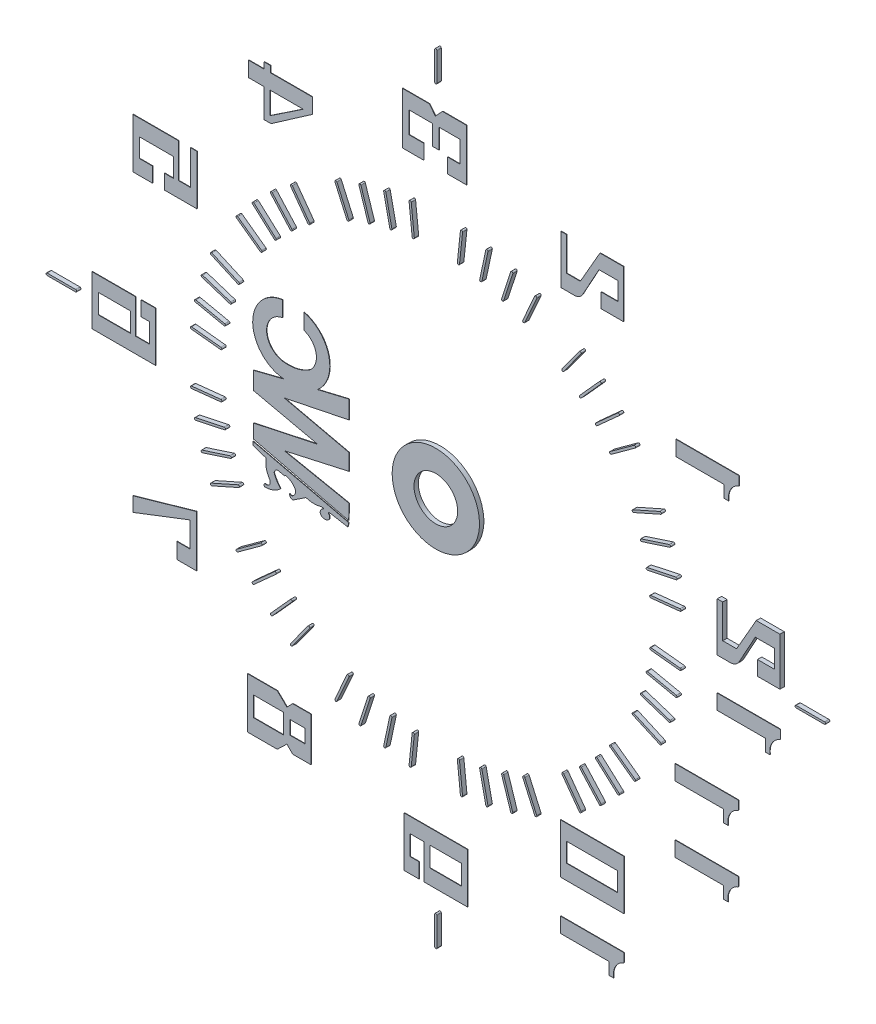
from build123d import *

# Parameters (mm, degrees)
BOSS_EXTRUDE1_OUTLINE_W   = 0.693153308
BOSS_EXTRUDE1_OUTLINE_H   = 0.62355464
BOSS_EXTRUDE1_OUTLINE_W_2 = 1.374444381
BOSS_EXTRUDE1_OUTLINE_H_2 = 0.902807992
BOSS_EXTRUDE1_OUTLINE_W_3 = 2.905976319
BOSS_EXTRUDE1_OUTLINE_H_3 = 2.27315436
BOSS_EXTRUDE1_OUTLINE_W_4 = 2.344736337
BOSS_EXTRUDE1_OUTLINE_H_4 = 0.874290332
BOSS_EXTRUDE1_OUTLINE_W_5 = 1.445092646
BOSS_EXTRUDE1_OUTLINE_H_5 = 0.908479698
BOSS_EXTRUDE1_OUTLINE_W_6 = 1.464797611
BOSS_EXTRUDE1_OUTLINE_H_6 = 0.892892655
BOSS_EXTRUDE1_OUTLINE_R   = 2
BOSS_EXTRUDE1_OUTLINE_R_2 = 1
BOSS_EXTRUDE1_DEPTH       = 0.2
CUT_EXTRUDE1_START        = -0.18
SKETCH4_R                 = 22.194214038
SKETCH4_R_2               = 11.335285241
SKETCH4_R_3               = 1.141976303
SKETCH4_R_4               = 1.14271963
SKETCH4_R_5               = 1.226028359
SKETCH4_R_6               = 1.09271963
SKETCH4_R_7               = 9.346177067
SKETCH4_R_8               = 3.583571814
CUT_EXTRUDE1_DEPTH        = 0.18


# Read off the part's stored shape, not the designer's step: Boss-Extrude1
with BuildPart() as part:
    # Boss-Extrude1 outline → Boss-Extrude1 (new body)
    # profile 1 of 70: a face of its own
    with BuildSketch(Plane(origin=(0, 0, 0), x_dir=(-1, 0, 0), z_dir=(0, 0, -1))):
        Polygon((10.955613983, -8.343638748), (11.85925555, -8.343638748), (11.85925555, -7.626212398), (11.24868691, -7.626212398), (11.24868691, -6.468547297), (13.870061363, -7.479466224), (13.870061363, -6.819107983), (10.955613983, -5.987545643), align=None)
    # profile 2 of 70: a face of its own
    with BuildSketch(Plane(origin=(0, 0, 0), x_dir=(-1, 0, 0), z_dir=(0, 0, -1))):
        Polygon((5.713113889, -13.412966941), (6.557142916, -13.412966941), (6.818567794, -13.143687857), (7.259255556, -13.570046465), (8.61866504, -13.570046465), (8.61866504, -11.252293033), (7.259255556, -11.252293033), (6.818567794, -11.678651641), (6.557142916, -11.409372556), (5.713113889, -11.409372556), align=None)
        with Locations((6.339051927, -12.411169749)):
            Rectangle(BOSS_EXTRUDE1_OUTLINE_W, BOSS_EXTRUDE1_OUTLINE_H, mode=Mode.SUBTRACT)
        with Locations((7.653607086, -12.410967049)):
            Rectangle(BOSS_EXTRUDE1_OUTLINE_W_2, BOSS_EXTRUDE1_OUTLINE_H_2, mode=Mode.SUBTRACT)
    # profile 3 of 70: a face of its own
    with BuildSketch(Plane(origin=(0, 0, 0), x_dir=(-1, 0, 0), z_dir=(0, 0, -1))):
        Polygon((7.875420776, 11.100165446), (7.875420776, 12.411169749), (8.576481811, 12.411169749), (8.576481811, 13.106065201), (7.862901797, 13.106065201), (7.862901797, 13.394413231), (7.574965976, 13.394413231), (7.574965976, 13.106065201), (5.659566961, 13.106065201), (5.659566961, 12.411169749), (7.549928117, 11.100165446), align=None)
        Polygon((7.594466881, 11.394557792), (6.072692174, 12.411169749), (7.594466881, 12.411169749), align=None, mode=Mode.SUBTRACT)
    # profile 4 of 70: a face of its own
    with BuildSketch(Plane(origin=(0, 0, 0), x_dir=(-1, 0, 0), z_dir=(0, 0, -1))):
        with Locations((-7.165592196, -11.018401973)):
            Rectangle(BOSS_EXTRUDE1_OUTLINE_W_3, BOSS_EXTRUDE1_OUTLINE_H_3)
        with Locations((-7.159356182, -11.030891763)):
            Rectangle(BOSS_EXTRUDE1_OUTLINE_W_4, BOSS_EXTRUDE1_OUTLINE_H_4, mode=Mode.SUBTRACT)
    # profile 5 of 70: a face of its own
    with BuildSketch(Plane(origin=(0, 0, 0), x_dir=(-1, 0, 0), z_dir=(0, 0, -1))):
        Polygon((13.580590302, 6.705510502), (12.971354188, 6.705510502), (12.971354188, 6.025389458), (13.880214604, 6.025389458), (13.880214604, 8.305794933), (11.78284429, 8.305794933), (11.78284429, 6.725514068), (11.233533036, 6.725514068), (11.233533036, 8.305794933), (10.943896144, 8.305794933), (10.943896144, 6.025389458), (12.422042834, 6.025389458), (12.422042834, 6.695508718), (12.021368813, 6.695508718), (12.021368813, 7.565663418), (13.580590302, 7.565663418), align=None)
    # profile 6 of 70: a face of its own
    with BuildSketch(Plane(origin=(0, 0, 0), x_dir=(-1, 0, 0), z_dir=(0, 0, -1))):
        Polygon((0.548614138, -13.87787068), (1.17251451, -13.87787068), (1.17251451, -14.786350378), (0.76513998, -14.786350378), (0.76513998, -15.472324961), (1.449221809, -15.472324961), (1.449221809, -13.190043821), (-1.449221809, -13.190043821), (-1.449221809, -15.472324961), (0.548614138, -15.472324961), align=None)
        with Locations((-0.446978155, -14.332110529)):
            Rectangle(BOSS_EXTRUDE1_OUTLINE_W_5, BOSS_EXTRUDE1_OUTLINE_H_5, mode=Mode.SUBTRACT)
    # profile 7 of 70: a face of its own
    with BuildSketch(Plane(origin=(0, 0, 0), x_dir=(-1, 0, 0), z_dir=(0, 0, -1))):
        Polygon((-1.413039117, 13.14806896), (-0.54342973, 13.14806896), (-0.54342973, 13.82316217), (-1.107496057, 13.82316217), (-1.107496057, 14.80824715), (-0.144455981, 14.80824715), (-0.144455981, 13.898937849), (0.144455981, 13.898937849), (0.144455981, 14.80824715), (1.231315442, 14.80824715), (1.231315442, 13.82316217), (0.550308579, 13.82316217), (0.550308579, 13.14806896), (1.528727873, 13.14806896), (1.528727873, 15.514299822), (0.297603982, 15.514299822), (0.018858966, 15.165369679), (-0.306343601, 15.514299822), (-1.413039117, 15.514299822), align=None)
    # profile 8 of 70: a face of its own
    with BuildSketch(Plane(origin=(0, 0, 0), x_dir=(-1, 0, 0), z_dir=(0, 0, -1))):
        Polygon((13.114345832, 0.464899605), (13.499321236, 0.464899605), (13.499321236, 1.133901722), (12.831275767, 1.133901722), (12.831275767, -1.133901722), (15.741236404, -1.133901722), (15.741236404, 1.133901722), (13.748422922, 1.133901722), (13.748422922, -0.430882673), (13.114345832, -0.430882673), align=None)
        with Locations((14.726297174, 0.00841343)):
            Rectangle(BOSS_EXTRUDE1_OUTLINE_W_6, BOSS_EXTRUDE1_OUTLINE_H_6, mode=Mode.SUBTRACT)
    # profile 9 of 70: a face of its own
    with BuildSketch(Plane(origin=(0, 0, 0), x_dir=(-1, 0, 0), z_dir=(0, 0, -1))):
        with BuildLine():
            ThreePointArc((-0.050002573, -17.800002573), (-2.573e-06, -17.850002573), (0.049997427, -17.800002573))
            Line((0.049997427, -17.800002573), (0.049997427, -16.5))
            ThreePointArc((0.049997427, -16.5), (-2.573e-06, -16.45), (-0.050002573, -16.5))
            Line((-0.050002573, -16.5), (-0.050002573, -17.800002573))
        make_face()
    # profile 10 of 70: a face of its own
    with BuildSketch(Plane(origin=(0, 0, 0), x_dir=(-1, 0, 0), z_dir=(0, 0, -1))):
        with BuildLine():
            ThreePointArc((16.5, 0.05), (16.45, 0), (16.5, -0.05))
            Line((16.5, -0.05), (17.8, -0.05))
            ThreePointArc((17.8, -0.05), (17.85, 0), (17.8, 0.05))
            Line((17.8, 0.05), (16.5, 0.05))
        make_face()
    # profile 11 of 70: a face of its own
    with BuildSketch(Plane(origin=(0, 0, 0), x_dir=(-1, 0, 0), z_dir=(0, 0, -1))):
        with BuildLine():
            ThreePointArc((-0.050002573, 16.5), (-2.573e-06, 16.45), (0.049997427, 16.5))
            Line((0.049997427, 16.5), (0.049997427, 17.799997427))
            ThreePointArc((0.049997427, 17.799997427), (-2.573e-06, 17.849997427), (-0.050002573, 17.799997427))
            Line((-0.050002573, 17.799997427), (-0.050002573, 16.5))
        make_face()
    # profile 12 of 70: a face of its own
    with BuildSketch(Plane(origin=(0, 0, 0), x_dir=(-1, 0, 0), z_dir=(0, 0, -1))):
        with BuildLine():
            ThreePointArc((-17.8, 0.05), (-17.85, 0), (-17.8, -0.05))
            Line((-17.8, -0.05), (-16.5, -0.05))
            ThreePointArc((-16.5, -0.05), (-16.45, 0), (-16.5, 0.05))
            Line((-16.5, 0.05), (-17.8, 0.05))
        make_face()
    # profile 13 of 70: a face of its own
    with BuildSketch(Plane(origin=(0, 0, 0), x_dir=(-1, 0, 0), z_dir=(0, 0, -1))):
        with BuildLine():
            ThreePointArc((-11.014555141, -2.290103622), (-11.053066936, -2.349406587), (-10.993763971, -2.387918382))
            Line((-10.993763971, -2.387918382), (-9.67326471, -2.107237599))
            ThreePointArc((-9.67326471, -2.107237599), (-9.634752915, -2.047934634), (-9.69405588, -2.009422839))
            Line((-9.69405588, -2.009422839), (-11.014555141, -2.290103622))
        make_face()
    # profile 14 of 70: a face of its own
    with BuildSketch(Plane(origin=(0, 0, 0), x_dir=(-1, 0, 0), z_dir=(0, 0, -1))):
        with BuildLine():
            ThreePointArc((-10.714835262, -3.428892657), (-10.746937238, -3.491896332), (-10.683933563, -3.523998309))
            Line((-10.683933563, -3.523998309), (-9.400007266, -3.106825366))
            ThreePointArc((-9.400007266, -3.106825366), (-9.36790529, -3.043821691), (-9.430908965, -3.011719715))
            Line((-9.430908965, -3.011719715), (-10.714835262, -3.428892657))
        make_face()
    # profile 15 of 70: a face of its own
    with BuildSketch(Plane(origin=(0, 0, 0), x_dir=(-1, 0, 0), z_dir=(0, 0, -1))):
        with BuildLine():
            ThreePointArc((-10.297721429, -4.530114009), (-10.323061869, -4.596128114), (-10.257047764, -4.621468555))
            Line((-10.257047764, -4.621468555), (-9.023761396, -4.072374087))
            ThreePointArc((-9.023761396, -4.072374087), (-8.998420956, -4.006359982), (-9.064435061, -3.981019541))
            Line((-9.064435061, -3.981019541), (-10.297721429, -4.530114009))
        make_face()
    # profile 16 of 70: a face of its own
    with BuildSketch(Plane(origin=(0, 0, 0), x_dir=(-1, 0, 0), z_dir=(0, 0, -1))):
        with BuildLine():
            ThreePointArc((-9.130827987, -6.572136627), (-9.141889575, -6.64197674), (-9.072049462, -6.653038327))
            Line((-9.072049462, -6.653038327), (-7.97987652, -5.859528236))
            ThreePointArc((-7.97987652, -5.859528236), (-7.968814933, -5.789688124), (-8.038655045, -5.778626536))
            Line((-8.038655045, -5.778626536), (-9.130827987, -6.572136627))
        make_face()
    # profile 17 of 70: a face of its own
    with BuildSketch(Plane(origin=(0, 0, 0), x_dir=(-1, 0, 0), z_dir=(0, 0, -1))):
        with BuildLine():
            ThreePointArc((-8.393833116, -7.49056508), (-8.397533827, -7.561178851), (-8.326920056, -7.564879562))
            Line((-8.326920056, -7.564879562), (-7.323674541, -6.661553243))
            ThreePointArc((-7.323674541, -6.661553243), (-7.31997383, -6.590939471), (-7.390587602, -6.587238761))
            Line((-7.390587602, -6.587238761), (-8.393833116, -7.49056508))
        make_face()
    # profile 18 of 70: a face of its own
    with BuildSketch(Plane(origin=(0, 0, 0), x_dir=(-1, 0, 0), z_dir=(0, 0, -1))):
        with BuildLine():
            ThreePointArc((-7.564873691, -8.326925342), (-7.56117298, -8.397539114), (-7.490559208, -8.393838403))
            Line((-7.490559208, -8.393838403), (-6.58723289, -7.390592888))
            ThreePointArc((-6.58723289, -7.390592888), (-6.590933601, -7.319979117), (-6.661547372, -7.323679828))
            Line((-6.661547372, -7.323679828), (-7.564873691, -8.326925342))
        make_face()
    # profile 19 of 70: a face of its own
    with BuildSketch(Plane(origin=(0, 0, 0), x_dir=(-1, 0, 0), z_dir=(0, 0, -1))):
        with BuildLine():
            ThreePointArc((-6.653031964, -9.072054085), (-6.641970376, -9.141894197), (-6.572130264, -9.13083261))
            Line((-6.572130264, -9.13083261), (-5.778620174, -8.038659668))
            ThreePointArc((-5.778620174, -8.038659668), (-5.789681761, -7.968819555), (-5.859521873, -7.979881143))
            Line((-5.859521873, -7.979881143), (-6.653031964, -9.072054085))
        make_face()
    # profile 20 of 70: a face of its own
    with BuildSketch(Plane(origin=(0, 0, 0), x_dir=(-1, 0, 0), z_dir=(0, 0, -1))):
        with BuildLine():
            ThreePointArc((-4.621461532, -10.257050891), (-4.596121091, -10.323064996), (-4.530106986, -10.297724555))
            Line((-4.530106986, -10.297724555), (-3.981012518, -9.064438188))
            ThreePointArc((-3.981012518, -9.064438188), (-4.006352959, -8.998424083), (-4.072367064, -9.023764523))
            Line((-4.072367064, -9.023764523), (-4.621461532, -10.257050891))
        make_face()
    # profile 21 of 70: a face of its own
    with BuildSketch(Plane(origin=(0, 0, 0), x_dir=(-1, 0, 0), z_dir=(0, 0, -1))):
        with BuildLine():
            ThreePointArc((-3.52399113, -10.683935895), (-3.491889154, -10.746939571), (-3.428885478, -10.714837595))
            Line((-3.428885478, -10.714837595), (-3.011712536, -9.430911298))
            ThreePointArc((-3.011712536, -9.430911298), (-3.043814512, -9.367907622), (-3.106818188, -9.400009598))
            Line((-3.106818188, -9.400009598), (-3.52399113, -10.683935895))
        make_face()
    # profile 22 of 70: a face of its own
    with BuildSketch(Plane(origin=(0, 0, 0), x_dir=(-1, 0, 0), z_dir=(0, 0, -1))):
        with BuildLine():
            ThreePointArc((-2.387911166, -10.993765505), (-2.349399371, -11.05306847), (-2.290096406, -11.014556674))
            Line((-2.290096406, -11.014556674), (-2.009415623, -9.694057413))
            ThreePointArc((-2.009415623, -9.694057413), (-2.047927419, -9.634754449), (-2.107230384, -9.673266244))
            Line((-2.107230384, -9.673266244), (-2.387911166, -10.993765505))
        make_face()
    # profile 23 of 70: a face of its own
    with BuildSketch(Plane(origin=(0, 0, 0), x_dir=(-1, 0, 0), z_dir=(0, 0, -1))):
        with BuildLine():
            ThreePointArc((-1.225668763, -11.183145167), (-1.181169092, -11.238097685), (-1.126216574, -11.193598013))
            Line((-1.126216574, -11.193598013), (-0.985103148, -9.850993455))
            ThreePointArc((-0.985103148, -9.850993455), (-1.02960282, -9.796040937), (-1.084555338, -9.840540608))
            Line((-1.084555338, -9.840540608), (-1.225668763, -11.183145167))
        make_face()
    # profile 24 of 70: a face of its own
    with BuildSketch(Plane(origin=(0, 0, 0), x_dir=(-1, 0, 0), z_dir=(0, 0, -1))):
        with BuildLine():
            ThreePointArc((1.084559943, -9.840540124), (1.029607425, -9.796040453), (0.985107754, -9.850992971))
            Line((0.985107754, -9.850992971), (1.126221179, -11.193597529))
            ThreePointArc((1.126221179, -11.193597529), (1.181173697, -11.238097201), (1.225673368, -11.183144683))
            Line((1.225673368, -11.183144683), (1.084559943, -9.840540124))
        make_face()
    # profile 25 of 70: a face of its own
    with BuildSketch(Plane(origin=(0, 0, 0), x_dir=(-1, 0, 0), z_dir=(0, 0, -1))):
        with BuildLine():
            ThreePointArc((2.107234913, -9.673265281), (2.047931948, -9.634753486), (2.009420153, -9.694056451))
            Line((2.009420153, -9.694056451), (2.290100936, -11.014555712))
            ThreePointArc((2.290100936, -11.014555712), (2.349403901, -11.053067507), (2.387915696, -10.993764542))
            Line((2.387915696, -10.993764542), (2.107234913, -9.673265281))
        make_face()
    # profile 26 of 70: a face of its own
    with BuildSketch(Plane(origin=(0, 0, 0), x_dir=(-1, 0, 0), z_dir=(0, 0, -1))):
        with BuildLine():
            ThreePointArc((3.428889882, -10.714836164), (3.491893558, -10.74693814), (3.523995534, -10.683934464))
            Line((3.523995534, -10.683934464), (3.106822592, -9.400008167))
            ThreePointArc((3.106822592, -9.400008167), (3.043818916, -9.367906191), (3.01171694, -9.430909867))
            Line((3.01171694, -9.430909867), (3.428889882, -10.714836164))
        make_face()
    # profile 27 of 70: a face of its own
    with BuildSketch(Plane(origin=(0, 0, 0), x_dir=(-1, 0, 0), z_dir=(0, 0, -1))):
        with BuildLine():
            ThreePointArc((4.072371294, -9.02376264), (4.006357189, -8.998422199), (3.981016748, -9.064436304))
            Line((3.981016748, -9.064436304), (4.530111217, -10.297722672))
            ThreePointArc((4.530111217, -10.297722672), (4.596125322, -10.323063113), (4.621465762, -10.257049008))
            Line((4.621465762, -10.257049008), (4.072371294, -9.02376264))
        make_face()
    # profile 28 of 70: a face of its own
    with BuildSketch(Plane(origin=(0, 0, 0), x_dir=(-1, 0, 0), z_dir=(0, 0, -1))):
        with BuildLine():
            ThreePointArc((6.572134011, -9.130829888), (6.641974123, -9.141891475), (6.65303571, -9.072051363))
            Line((6.65303571, -9.072051363), (5.85952562, -7.979878421))
            ThreePointArc((5.85952562, -7.979878421), (5.789685508, -7.968816834), (5.77862392, -8.038656946))
            Line((5.77862392, -8.038656946), (6.572134011, -9.130829888))
        make_face()
    # profile 29 of 70: a face of its own
    with BuildSketch(Plane(origin=(0, 0, 0), x_dir=(-1, 0, 0), z_dir=(0, 0, -1))):
        with BuildLine():
            ThreePointArc((6.661550814, -7.323676729), (6.590937042, -7.319976018), (6.587236331, -7.39058979))
            Line((6.587236331, -7.39058979), (7.49056265, -8.393835304))
            ThreePointArc((7.49056265, -8.393835304), (7.561176421, -8.397536015), (7.564877132, -8.326922244))
            Line((7.564877132, -8.326922244), (6.661550814, -7.323676729))
        make_face()
    # profile 30 of 70: a face of its own
    with BuildSketch(Plane(origin=(0, 0, 0), x_dir=(-1, 0, 0), z_dir=(0, 0, -1))):
        with BuildLine():
            ThreePointArc((8.326923154, -7.564876121), (8.397536926, -7.56117541), (8.393836215, -7.490561638))
            Line((8.393836215, -7.490561638), (7.3905907, -6.58723532))
            ThreePointArc((7.3905907, -6.58723532), (7.319976929, -6.590936031), (7.32367764, -6.661549802))
            Line((7.32367764, -6.661549802), (8.326923154, -7.564876121))
        make_face()
    # profile 31 of 70: a face of its own
    with BuildSketch(Plane(origin=(0, 0, 0), x_dir=(-1, 0, 0), z_dir=(0, 0, -1))):
        with BuildLine():
            ThreePointArc((8.038657767, -5.77862279), (7.968817655, -5.789684378), (7.979879242, -5.85952449))
            Line((7.979879242, -5.85952449), (9.072052184, -6.65303458))
            ThreePointArc((9.072052184, -6.65303458), (9.141892296, -6.641972993), (9.130830709, -6.572132881))
            Line((9.130830709, -6.572132881), (8.038657767, -5.77862279))
        make_face()
    # profile 32 of 70: a face of its own
    with BuildSketch(Plane(origin=(0, 0, 0), x_dir=(-1, 0, 0), z_dir=(0, 0, -1))):
        with BuildLine():
            ThreePointArc((9.430910396, -3.011715311), (9.367906721, -3.043817287), (9.400008697, -3.106820962))
            Line((9.400008697, -3.106820962), (10.683934994, -3.523993905))
            ThreePointArc((10.683934994, -3.523993905), (10.746938669, -3.491891928), (10.714836693, -3.428888253))
            Line((10.714836693, -3.428888253), (9.430910396, -3.011715311))
        make_face()
    # profile 33 of 70: a face of its own
    with BuildSketch(Plane(origin=(0, 0, 0), x_dir=(-1, 0, 0), z_dir=(0, 0, -1))):
        with BuildLine():
            ThreePointArc((9.064436944, -3.981015311), (8.998422839, -4.006355751), (9.02376328, -4.072369856))
            Line((9.02376328, -4.072369856), (10.257049648, -4.621464325))
            ThreePointArc((10.257049648, -4.621464325), (10.323063753, -4.596123884), (10.297723312, -4.530109779))
            Line((10.297723312, -4.530109779), (9.064436944, -3.981015311))
        make_face()
    # profile 34 of 70: a face of its own
    with BuildSketch(Plane(origin=(0, 0, 0), x_dir=(-1, 0, 0), z_dir=(0, 0, -1))):
        with BuildLine():
            ThreePointArc((9.694056842, -2.00941831), (9.634753878, -2.047930106), (9.673265673, -2.10723307))
            Line((9.673265673, -2.10723307), (10.993764934, -2.387913852))
            ThreePointArc((10.993764934, -2.387913852), (11.053067899, -2.349402057), (11.014556103, -2.290099092))
            Line((11.014556103, -2.290099092), (9.694056842, -2.00941831))
        make_face()
    # profile 35 of 70: a face of its own
    with BuildSketch(Plane(origin=(0, 0, 0), x_dir=(-1, 0, 0), z_dir=(0, 0, -1))):
        with BuildLine():
            ThreePointArc((9.850993189, -0.985105679), (9.796040671, -1.029605351), (9.840540342, -1.084557869))
            Line((9.840540342, -1.084557869), (11.183144901, -1.225671294))
            ThreePointArc((11.183144901, -1.225671294), (11.238097419, -1.181171622), (11.193597747, -1.126219104))
            Line((11.193597747, -1.126219104), (9.850993189, -0.985105679))
        make_face()
    # profile 36 of 70: a face of its own
    with BuildSketch(Plane(origin=(0, 0, 0), x_dir=(-1, 0, 0), z_dir=(0, 0, -1))):
        with BuildLine():
            ThreePointArc((11.193598229, 1.126214524), (11.2380979, 1.181167042), (11.183145382, 1.225666714))
            Line((11.183145382, 1.225666714), (9.85099367, 1.085651927))
            ThreePointArc((9.85099367, 1.085651927), (9.80099367, 1.030121301), (9.861446516, 0.986199737))
            Line((9.861446516, 0.986199737), (11.193598229, 1.126214524))
        make_face()
    # profile 37 of 70: a face of its own
    with BuildSketch(Plane(origin=(0, 0, 0), x_dir=(-1, 0, 0), z_dir=(0, 0, -1))):
        with BuildLine():
            ThreePointArc((9.673266615, 2.107228639), (9.634754819, 2.047925674), (9.694057784, 2.009413879))
            Line((9.694057784, 2.009413879), (11.014557045, 2.290094662))
            ThreePointArc((11.014557045, 2.290094662), (11.053068841, 2.349397627), (10.993765876, 2.387909422))
            Line((10.993765876, 2.387909422), (9.673266615, 2.107228639))
        make_face()
    # profile 38 of 70: a face of its own
    with BuildSketch(Plane(origin=(0, 0, 0), x_dir=(-1, 0, 0), z_dir=(0, 0, -1))):
        with BuildLine():
            ThreePointArc((9.400010058, 3.106816774), (9.367908081, 3.043813098), (9.430911757, 3.011711122))
            Line((9.430911757, 3.011711122), (10.714838054, 3.428884065))
            ThreePointArc((10.714838054, 3.428884065), (10.74694003, 3.49188774), (10.683936355, 3.523989716))
            Line((10.683936355, 3.523989716), (9.400010058, 3.106816774))
        make_face()
    # profile 39 of 70: a face of its own
    with BuildSketch(Plane(origin=(0, 0, 0), x_dir=(-1, 0, 0), z_dir=(0, 0, -1))):
        with BuildLine():
            ThreePointArc((9.023765001, 4.072365992), (8.99842456, 4.006351887), (9.064438665, 3.981011446))
            Line((9.064438665, 3.981011446), (10.297725033, 4.530105914))
            ThreePointArc((10.297725033, 4.530105914), (10.323065473, 4.596120019), (10.257051368, 4.62146046))
            Line((10.257051368, 4.62146046), (9.023765001, 4.072365992))
        make_face()
    # profile 40 of 70: a face of its own
    with BuildSketch(Plane(origin=(0, 0, 0), x_dir=(-1, 0, 0), z_dir=(0, 0, -1))):
        with BuildLine():
            ThreePointArc((7.979881444, 5.859521459), (7.968819856, 5.789681346), (8.038659969, 5.778619759))
            Line((8.038659969, 5.778619759), (9.130832911, 6.57212985))
            ThreePointArc((9.130832911, 6.57212985), (9.141894498, 6.641969962), (9.072054386, 6.653031549))
            Line((9.072054386, 6.653031549), (7.979881444, 5.859521459))
        make_face()
    # profile 41 of 70: a face of its own
    with BuildSketch(Plane(origin=(0, 0, 0), x_dir=(-1, 0, 0), z_dir=(0, 0, -1))):
        with BuildLine():
            ThreePointArc((7.323679942, 6.661547245), (7.319979232, 6.590933473), (7.390593003, 6.587232762))
            Line((7.390593003, 6.587232762), (8.393838517, 7.490559081))
            ThreePointArc((8.393838517, 7.490559081), (8.397539228, 7.561172852), (8.326925457, 7.564873564))
            Line((8.326925457, 7.564873564), (7.323679942, 6.661547245))
        make_face()
    # profile 42 of 70: a face of its own
    with BuildSketch(Plane(origin=(0, 0, 0), x_dir=(-1, 0, 0), z_dir=(0, 0, -1))):
        with BuildLine():
            ThreePointArc((7.564879435, 8.32692017), (7.561178724, 8.397533942), (7.490564952, 8.393833231))
            Line((7.490564952, 8.393833231), (6.587238634, 7.390587717))
            ThreePointArc((6.587238634, 7.390587717), (6.590939344, 7.319973945), (6.661553116, 7.323674656))
            Line((6.661553116, 7.323674656), (7.564879435, 8.32692017))
        make_face()
    # profile 43 of 70: a face of its own
    with BuildSketch(Plane(origin=(0, 0, 0), x_dir=(-1, 0, 0), z_dir=(0, 0, -1))):
        with BuildLine():
            ThreePointArc((6.653037912, 9.072049763), (6.641976326, 9.141889876), (6.572136213, 9.130828289))
            Line((6.572136213, 9.130828289), (5.778626122, 8.038655346))
            ThreePointArc((5.778626122, 8.038655346), (5.78968771, 7.968815234), (5.859527822, 7.979876821))
            Line((5.859527822, 7.979876821), (6.653037912, 9.072049763))
        make_face()
    # profile 44 of 70: a face of its own
    with BuildSketch(Plane(origin=(0, 0, 0), x_dir=(-1, 0, 0), z_dir=(0, 0, -1))):
        with BuildLine():
            ThreePointArc((4.621467483, 10.257048242), (4.596127042, 10.323062347), (4.530112937, 10.297721906))
            Line((4.530112937, 10.297721906), (3.981018469, 9.064435538))
            ThreePointArc((3.981018469, 9.064435538), (4.00635891, 8.998421433), (4.072373015, 9.023761874))
            Line((4.072373015, 9.023761874), (4.621467483, 10.257048242))
        make_face()
    # profile 45 of 70: a face of its own
    with BuildSketch(Plane(origin=(0, 0, 0), x_dir=(-1, 0, 0), z_dir=(0, 0, -1))):
        with BuildLine():
            ThreePointArc((3.523996895, 10.683934022), (3.491894919, 10.746937698), (3.428891243, 10.714835721))
            Line((3.428891243, 10.714835721), (3.011718301, 9.430909424))
            ThreePointArc((3.011718301, 9.430909424), (3.043820278, 9.367905749), (3.106823953, 9.400007725))
            Line((3.106823953, 9.400007725), (3.523996895, 10.683934022))
        make_face()
    # profile 46 of 70: a face of its own
    with BuildSketch(Plane(origin=(0, 0, 0), x_dir=(-1, 0, 0), z_dir=(0, 0, -1))):
        with BuildLine():
            ThreePointArc((2.387916637, 10.993764342), (2.349404842, 11.053067307), (2.290101877, 11.014555511))
            Line((2.290101877, 11.014555511), (2.009421095, 9.69405625))
            ThreePointArc((2.009421095, 9.69405625), (2.047932891, 9.634753286), (2.107235855, 9.673265081))
            Line((2.107235855, 9.673265081), (2.387916637, 10.993764342))
        make_face()
    # profile 47 of 70: a face of its own
    with BuildSketch(Plane(origin=(0, 0, 0), x_dir=(-1, 0, 0), z_dir=(0, 0, -1))):
        with BuildLine():
            ThreePointArc((1.22567385, 11.183144632), (1.181174178, 11.23809715), (1.12622166, 11.193597479))
            Line((1.12622166, 11.193597479), (0.985108235, 9.85099292))
            ThreePointArc((0.985108235, 9.85099292), (1.029607906, 9.796040402), (1.084560424, 9.840540074))
            Line((1.084560424, 9.840540074), (1.22567385, 11.183144632))
        make_face()
    # profile 48 of 70: a face of its own
    with BuildSketch(Plane(origin=(0, 0, 0), x_dir=(-1, 0, 0), z_dir=(0, 0, -1))):
        with BuildLine():
            ThreePointArc((-1.126217055, 11.193597963), (-1.181169573, 11.238097634), (-1.225669245, 11.183145116))
            Line((-1.225669245, 11.183145116), (-1.084555819, 9.840540558))
            ThreePointArc((-1.084555819, 9.840540558), (-1.029603301, 9.796040886), (-0.98510363, 9.850993404))
            Line((-0.98510363, 9.850993404), (-1.126217055, 11.193597963))
        make_face()
    # profile 49 of 70: a face of its own
    with BuildSketch(Plane(origin=(0, 0, 0), x_dir=(-1, 0, 0), z_dir=(0, 0, -1))):
        with BuildLine():
            ThreePointArc((-2.290097348, 11.014556474), (-2.349400313, 11.05306827), (-2.387912108, 10.993765305))
            Line((-2.387912108, 10.993765305), (-2.107231325, 9.673266044))
            ThreePointArc((-2.107231325, 9.673266044), (-2.047928361, 9.634754249), (-2.009416565, 9.694057213))
            Line((-2.009416565, 9.694057213), (-2.290097348, 11.014556474))
        make_face()
    # profile 50 of 70: a face of its own
    with BuildSketch(Plane(origin=(0, 0, 0), x_dir=(-1, 0, 0), z_dir=(0, 0, -1))):
        with BuildLine():
            ThreePointArc((-3.428886839, 10.714837152), (-3.491890515, 10.746939129), (-3.523992491, 10.683935453))
            Line((-3.523992491, 10.683935453), (-3.106819549, 9.400009156))
            ThreePointArc((-3.106819549, 9.400009156), (-3.043815874, 9.36790718), (-3.011713897, 9.430910855))
            Line((-3.011713897, 9.430910855), (-3.428886839, 10.714837152))
        make_face()
    # profile 51 of 70: a face of its own
    with BuildSketch(Plane(origin=(0, 0, 0), x_dir=(-1, 0, 0), z_dir=(0, 0, -1))):
        with BuildLine():
            ThreePointArc((-4.530108707, 10.297723789), (-4.596122812, 10.32306423), (-4.621463253, 10.257050125))
            Line((-4.621463253, 10.257050125), (-4.072368784, 9.023763757))
            ThreePointArc((-4.072368784, 9.023763757), (-4.006354679, 8.998423316), (-3.981014239, 9.064437422))
            Line((-3.981014239, 9.064437422), (-4.530108707, 10.297723789))
        make_face()
    # profile 52 of 70: a face of its own
    with BuildSketch(Plane(origin=(0, 0, 0), x_dir=(-1, 0, 0), z_dir=(0, 0, -1))):
        with BuildLine():
            ThreePointArc((-6.572132466, 9.13083101), (-6.641972578, 9.141892597), (-6.653034166, 9.072052485))
            Line((-6.653034166, 9.072052485), (-5.859524075, 7.979879543))
            ThreePointArc((-5.859524075, 7.979879543), (-5.789683963, 7.968817956), (-5.778622376, 8.038658068))
            Line((-5.778622376, 8.038658068), (-6.572132466, 9.13083101))
        make_face()
    # profile 53 of 70: a face of its own
    with BuildSketch(Plane(origin=(0, 0, 0), x_dir=(-1, 0, 0), z_dir=(0, 0, -1))):
        with BuildLine():
            ThreePointArc((-7.490561511, 8.39383633), (-7.561175283, 8.39753704), (-7.564875994, 8.326923269))
            Line((-7.564875994, 8.326923269), (-6.661549675, 7.323677755))
            ThreePointArc((-6.661549675, 7.323677755), (-6.590935904, 7.319977044), (-6.587235192, 7.390590815))
            Line((-6.587235192, 7.390590815), (-7.490561511, 8.39383633))
        make_face()
    # profile 54 of 70: a face of its own
    with BuildSketch(Plane(origin=(0, 0, 0), x_dir=(-1, 0, 0), z_dir=(0, 0, -1))):
        with BuildLine():
            ThreePointArc((-8.326922358, 7.564877005), (-8.39753613, 7.561176294), (-8.393835419, 7.490562522))
            Line((-8.393835419, 7.490562522), (-7.390589905, 6.587236204))
            ThreePointArc((-7.390589905, 6.587236204), (-7.319976133, 6.590936914), (-7.323676844, 6.661550686))
            Line((-7.323676844, 6.661550686), (-8.326922358, 7.564877005))
        make_face()
    # profile 55 of 70: a face of its own
    with BuildSketch(Plane(origin=(0, 0, 0), x_dir=(-1, 0, 0), z_dir=(0, 0, -1))):
        with BuildLine():
            ThreePointArc((-9.072051664, 6.653035296), (-9.141891777, 6.641973709), (-9.130830189, 6.572133596))
            Line((-9.130830189, 6.572133596), (-8.038657247, 5.778623506))
            ThreePointArc((-8.038657247, 5.778623506), (-7.968817135, 5.789685093), (-7.979878722, 5.859525205))
            Line((-7.979878722, 5.859525205), (-9.072051664, 6.653035296))
        make_face()
    # profile 56 of 70: a face of its own
    with BuildSketch(Plane(origin=(0, 0, 0), x_dir=(-1, 0, 0), z_dir=(0, 0, -1))):
        with BuildLine():
            ThreePointArc((-10.257049485, 4.62146469), (-10.32306359, 4.59612425), (-10.297723149, 4.530110145))
            Line((-10.297723149, 4.530110145), (-9.064436781, 3.981015676))
            ThreePointArc((-9.064436781, 3.981015676), (-8.998422676, 4.006356117), (-9.023763117, 4.072370222))
            Line((-9.023763117, 4.072370222), (-10.257049485, 4.62146469))
        make_face()
    # profile 57 of 70: a face of its own
    with BuildSketch(Plane(origin=(0, 0, 0), x_dir=(-1, 0, 0), z_dir=(0, 0, -1))):
        with BuildLine():
            ThreePointArc((-10.683934924, 3.52399412), (-10.746938599, 3.491892144), (-10.714836623, 3.428888469))
            Line((-10.714836623, 3.428888469), (-9.430910326, 3.011715526))
            ThreePointArc((-9.430910326, 3.011715526), (-9.36790665, 3.043817502), (-9.400008627, 3.106821178))
            Line((-9.400008627, 3.106821178), (-10.683934924, 3.52399412))
        make_face()
    # profile 58 of 70: a face of its own
    with BuildSketch(Plane(origin=(0, 0, 0), x_dir=(-1, 0, 0), z_dir=(0, 0, -1))):
        with BuildLine():
            ThreePointArc((-10.993764913, 2.387913951), (-11.053067878, 2.349402156), (-11.014556082, 2.290099191))
            Line((-11.014556082, 2.290099191), (-9.694056821, 2.009418409))
            ThreePointArc((-9.694056821, 2.009418409), (-9.634753857, 2.047930205), (-9.673265652, 2.107233169))
            Line((-9.673265652, 2.107233169), (-10.993764913, 2.387913951))
        make_face()
    # profile 59 of 70: a face of its own
    with BuildSketch(Plane(origin=(0, 0, 0), x_dir=(-1, 0, 0), z_dir=(0, 0, -1))):
        with BuildLine():
            ThreePointArc((-11.183144898, 1.225671319), (-11.238097416, 1.181171648), (-11.193597745, 1.12621913))
            Line((-11.193597745, 1.12621913), (-9.850993186, 0.985105704))
            ThreePointArc((-9.850993186, 0.985105704), (-9.796040668, 1.029605376), (-9.84054034, 1.084557894))
            Line((-9.84054034, 1.084557894), (-11.183144898, 1.225671319))
        make_face()
    # profile 60 of 70: a face of its own
    with BuildSketch(Plane(origin=(0, 0, 0), x_dir=(-1, 0, 0), z_dir=(0, 0, -1))):
        with BuildLine():
            ThreePointArc((-11.193597263, -1.12622371), (-11.238096935, -1.181176228), (-11.183144417, -1.225675899))
            Line((-11.183144417, -1.225675899), (-9.840539858, -1.084562474))
            ThreePointArc((-9.840539858, -1.084562474), (-9.796040187, -1.029609956), (-9.850992705, -0.985110284))
            Line((-9.850992705, -0.985110284), (-11.193597263, -1.12622371))
        make_face()
    # profile 61 of 70: a face of its own
    with BuildSketch(Plane(origin=(0, 0, 0), x_dir=(-1, 0, 0), z_dir=(0, 0, -1))):
        with BuildLine():
            ThreePointArc((7.594083504, -3.060004335), (7.72910182, -2.801447131), (7.784202164, -2.51501088))
            Line((7.784202164, -2.51501088), (7.784202164, -2.272262332))
            Line((7.784202164, -2.272262332), (8.371193855, -2.062831262))
            Line((8.371193855, -2.062831262), (8.371193855, -1.910518638))
            Line((8.371193855, -1.910518638), (3.984640861, -2.944385022))
            Line((3.984640861, -2.944385022), (4.030370013, -3.138407532))
            Line((4.030370013, -3.138407532), (4.870623284, -2.990020892))
            ThreePointArc((4.870623284, -2.990020892), (4.910585273, -3.012869007), (4.905829389, -3.058655233))
            ThreePointArc((4.905829389, -3.058655233), (4.862238461, -3.147402833), (4.876402005, -3.245258336))
            ThreePointArc((4.876402005, -3.245258336), (5.085797667, -3.357639221), (5.290124946, -3.236286967))
            ThreePointArc((5.290124946, -3.236286967), (5.266378525, -3.077119455), (5.143444748, -2.973266309))
            Line((5.143444748, -2.973266309), (5.143444748, -2.941174186))
            Line((5.143444748, -2.941174186), (5.251999892, -2.941174186))
            ThreePointArc((5.251999892, -2.941174186), (5.599542057, -2.989176785), (5.945344104, -2.9299252))
            Line((5.945344104, -2.9299252), (6.493267717, -3.29283844))
            ThreePointArc((6.493267717, -3.29283844), (6.539709126, -3.318679627), (6.592828816, -3.320373705))
            ThreePointArc((6.592828816, -3.320373705), (6.671973479, -3.251264451), (6.696711825, -3.149146965))
            ThreePointArc((6.696711825, -3.149146965), (6.617343935, -3.179783657), (6.53619828, -3.154224871))
            Line((6.53619828, -3.154224871), (6.464047094, -3.074169904))
            ThreePointArc((6.464047094, -3.074169904), (6.422400962, -2.923220734), (6.477926362, -2.776806998))
            ThreePointArc((6.477926362, -2.776806998), (6.659898083, -2.610209339), (6.888983528, -2.518621426))
            Line((6.888983528, -2.518621426), (6.921214753, -2.559460704))
            Line((6.921214753, -2.559460704), (7.194467742, -2.501233541))
            ThreePointArc((7.194467742, -2.501233541), (7.348966291, -2.545215206), (7.39932752, -2.697753514))
            ThreePointArc((7.39932752, -2.697753514), (7.277287259, -2.942158804), (7.112256519, -3.15985728))
            ThreePointArc((7.112256519, -3.15985728), (7.447730491, -3.380056197), (7.843486273, -3.446446783))
            ThreePointArc((7.843486273, -3.446446783), (7.866148345, -3.350113703), (7.769815265, -3.32745163))
            ThreePointArc((7.769815265, -3.32745163), (7.664933643, -3.294139438), (7.594083504, -3.209936619))
            Line((7.594083504, -3.209936619), (7.594083504, -3.060004335))
        make_face()
    # profile 62 of 70: a face of its own
    with BuildSketch(Plane(origin=(0, 0, 0), x_dir=(-1, 0, 0), z_dir=(0, 0, -1))):
        with BuildLine():
            ThreePointArc((6.962011879, 1.265990101), (8.387422625, 2.794656956), (7.021780186, 4.376946081))
            Line((7.021780186, 4.376946081), (7.021780186, 3.664050111))
            ThreePointArc((7.021780186, 3.664050111), (7.74959424, 2.764854927), (6.942027927, 1.936542229))
            ThreePointArc((6.942027927, 1.936542229), (6.328812914, 1.977541602), (5.76796648, 2.228867842))
            ThreePointArc((5.76796648, 2.228867842), (5.483866433, 3.027222663), (6.047144748, 3.660310964))
            Line((6.047144748, 3.660310964), (6.047144748, 4.376946081))
            ThreePointArc((6.047144748, 4.376946081), (4.894139871, 3.189615042), (5.418237812, 1.619743522))
            Line((5.418237812, 1.619743522), (3.975452119, 1.962626482))
            Line((3.975452119, 1.962626482), (3.975452119, 1.134256133))
            Line((3.975452119, 1.134256133), (6.948525032, 0.525102696))
            Line((6.948525032, 0.525102696), (3.975452119, -0.157174))
            Line((3.975452119, -0.157174), (3.975452119, -0.9055397))
            Line((3.975452119, -0.9055397), (6.944157762, -1.56797538))
            Line((6.944157762, -1.56797538), (3.975452119, -2.168430022))
            Line((3.975452119, -2.168430022), (3.990748114, -2.864760671))
            Line((3.990748114, -2.864760671), (8.353900943, -1.809704821))
            Line((8.353900943, -1.809704821), (8.353900943, -1.175440135))
            Line((8.353900943, -1.175440135), (5.416564747, -0.546598546))
            Line((5.416564747, -0.546598546), (8.353900943, 0.113248119))
            Line((8.353900943, 0.113248119), (8.353900943, 0.916538762))
            Line((8.353900943, 0.916538762), (6.962011879, 1.265990101))
        make_face()
    # profile 63 of 70: a face of its own
    with BuildSketch(Plane(origin=(0, 0, 0), x_dir=(-1, 0, 0), z_dir=(0, 0, -1))):
        Circle(BOSS_EXTRUDE1_OUTLINE_R)
        Circle(BOSS_EXTRUDE1_OUTLINE_R_2, mode=Mode.SUBTRACT)
    # profile 64 of 70: a face of its own
    with BuildSketch(Plane(origin=(0, 0, 0), x_dir=(-1, 0, 0), z_dir=(0, 0, -1))):
        with BuildLine():
            Line((-13.888967779, 7.85624906), (-13.888967779, 7.450391139))
            ThreePointArc((-13.888967779, 7.450391139), (-13.503336053, 7.117237899), (-13.418130373, 6.614800937))
            Line((-13.418130373, 6.614800937), (-13.20859812, 6.614800937))
            Line((-13.20859812, 6.614800937), (-13.20859812, 7.165592195))
            Line((-13.20859812, 7.165592195), (-10.994604876, 7.165592195))
            Line((-10.994604876, 7.165592195), (-10.994604876, 7.85624906))
            Line((-10.994604876, 7.85624906), (-13.888967779, 7.85624906))
        make_face()
    # profile 65 of 70: a face of its own
    with BuildSketch(Plane(origin=(0, 0, 0), x_dir=(-1, 0, 0), z_dir=(0, 0, -1))):
        with BuildLine():
            ThreePointArc((-6.721040289, 11.451601825), (-6.548222056, 11.292054795), (-6.319166427, 11.238623386))
            Line((-6.319166427, 11.238623386), (-5.731049049, 11.238623386))
            Line((-5.731049049, 11.238623386), (-5.731049049, 13.470688323))
            Line((-5.731049049, 13.470688323), (-5.983215732, 13.470688323))
            Line((-5.983215732, 13.470688323), (-5.983215732, 11.933562864))
            Line((-5.983215732, 11.933562864), (-6.619114315, 11.933562864))
            Line((-6.619114315, 11.933562864), (-7.518143432, 13.503626863))
            Line((-7.518143432, 13.503626863), (-8.603556623, 13.503626863))
            Line((-8.603556623, 13.503626863), (-8.603556623, 11.318712635))
            Line((-8.603556623, 11.318712635), (-7.573809834, 11.318712635))
            Line((-7.573809834, 11.318712635), (-7.573809834, 11.986234628))
            Line((-7.573809834, 11.986234628), (-8.34962188, 11.986234628))
            Line((-8.34962188, 11.986234628), (-8.34962188, 12.820707457))
            Line((-8.34962188, 12.820707457), (-7.473241606, 12.820707457))
            Line((-7.473241606, 12.820707457), (-6.721040289, 11.451601825))
        make_face()
    # profile 66 of 70: a face of its own
    with BuildSketch(Plane(origin=(0, 0, 0), x_dir=(-1, 0, 0), z_dir=(0, 0, -1))):
        with BuildLine():
            Line((-8.614930589, -13.699066582), (-8.614930589, -14.104924503))
            ThreePointArc((-8.614930589, -14.104924503), (-8.229298863, -14.438077742), (-8.144093184, -14.940514705))
            Line((-8.144093184, -14.940514705), (-7.934560931, -14.940514705))
            Line((-7.934560931, -14.940514705), (-7.934560931, -14.389723446))
            Line((-7.934560931, -14.389723446), (-5.720567686, -14.389723446))
            Line((-5.720567686, -14.389723446), (-5.720567686, -13.699066582))
            Line((-5.720567686, -13.699066582), (-8.614930589, -13.699066582))
        make_face()
    # profile 67 of 70: a face of its own
    with BuildSketch(Plane(origin=(0, 0, 0), x_dir=(-1, 0, 0), z_dir=(0, 0, -1))):
        with BuildLine():
            Line((-13.8583512, -5.029001194), (-13.8583512, -5.434859115))
            ThreePointArc((-13.8583512, -5.434859115), (-13.472719474, -5.768012355), (-13.387513795, -6.270449317))
            Line((-13.387513795, -6.270449317), (-13.177981542, -6.270449317))
            Line((-13.177981542, -6.270449317), (-13.177981542, -5.719658058))
            Line((-13.177981542, -5.719658058), (-10.963988297, -5.719658058))
            Line((-10.963988297, -5.719658058), (-10.963988297, -5.029001194))
            Line((-10.963988297, -5.029001194), (-13.8583512, -5.029001194))
        make_face()
    # profile 68 of 70: a face of its own
    with BuildSketch(Plane(origin=(0, 0, 0), x_dir=(-1, 0, 0), z_dir=(0, 0, -1))):
        with BuildLine():
            Line((-13.8583512, -8.060735074), (-13.8583512, -8.466592995))
            ThreePointArc((-13.8583512, -8.466592995), (-13.472719474, -8.799746234), (-13.387513795, -9.302183197))
            Line((-13.387513795, -9.302183197), (-13.177981542, -9.302183197))
            Line((-13.177981542, -9.302183197), (-13.177981542, -8.751391938))
            Line((-13.177981542, -8.751391938), (-10.963988297, -8.751391938))
            Line((-10.963988297, -8.751391938), (-10.963988297, -8.060735074))
            Line((-10.963988297, -8.060735074), (-13.8583512, -8.060735074))
        make_face()
    # profile 69 of 70: a face of its own
    with BuildSketch(Plane(origin=(0, 0, 0), x_dir=(-1, 0, 0), z_dir=(0, 0, -1))):
        with BuildLine():
            ThreePointArc((-13.87920316, 0.453136922), (-13.706384927, 0.293589892), (-13.477329298, 0.240158484))
            Line((-13.477329298, 0.240158484), (-12.88921192, 0.240158484))
            Line((-12.88921192, 0.240158484), (-12.88921192, 2.47222342))
            Line((-12.88921192, 2.47222342), (-13.141378603, 2.47222342))
            Line((-13.141378603, 2.47222342), (-13.141378603, 0.935097961))
            Line((-13.141378603, 0.935097961), (-13.777277186, 0.935097961))
            Line((-13.777277186, 0.935097961), (-14.676306303, 2.50516196))
            Line((-14.676306303, 2.50516196), (-15.761719494, 2.50516196))
            Line((-15.761719494, 2.50516196), (-15.761719494, 0.320247732))
            Line((-15.761719494, 0.320247732), (-14.731972705, 0.320247732))
            Line((-14.731972705, 0.320247732), (-14.731972705, 0.987769725))
            Line((-14.731972705, 0.987769725), (-15.50778475, 0.987769725))
            Line((-15.50778475, 0.987769725), (-15.50778475, 1.822242554))
            Line((-15.50778475, 1.822242554), (-14.631404477, 1.822242554))
            Line((-14.631404477, 1.822242554), (-13.87920316, 0.453136922))
        make_face()
    # profile 70 of 70: a face of its own
    with BuildSketch(Plane(origin=(0, 0, 0), x_dir=(-1, 0, 0), z_dir=(0, 0, -1))):
        with BuildLine():
            Line((-15.778365843, -1.263713837), (-15.778365843, -1.669571758))
            ThreePointArc((-15.778365843, -1.669571758), (-15.392734116, -2.002724997), (-15.307528437, -2.50516196))
            Line((-15.307528437, -2.50516196), (-15.097996184, -2.50516196))
            Line((-15.097996184, -2.50516196), (-15.097996184, -1.954370701))
            Line((-15.097996184, -1.954370701), (-12.884002939, -1.954370701))
            Line((-12.884002939, -1.954370701), (-12.884002939, -1.263713837))
            Line((-12.884002939, -1.263713837), (-15.778365843, -1.263713837))
        make_face()
    extrude(amount=BOSS_EXTRUDE1_DEPTH)

    # Sketch4 → Cut-Extrude1 (cut)
    # profile 1 of 2: a face of its own
    with BuildSketch(Plane(origin=(0, 0, -0.2), x_dir=(-1, 0, 0), z_dir=(0, 0, -1)).offset(CUT_EXTRUDE1_START)):
        Circle(SKETCH4_R)
        Circle(SKETCH4_R_2, mode=Mode.SUBTRACT)
        with Locations((-0.050002573, -17.150001286)):
            Circle(SKETCH4_R_3, mode=Mode.SUBTRACT)
        with Locations((17.042420802, 0)):
            Circle(SKETCH4_R_4, mode=Mode.SUBTRACT)
        with Locations((-0.050002573, 17.149998714)):
            Circle(SKETCH4_R_5, mode=Mode.SUBTRACT)
        with Locations((-17.15, -0.05)):
            Circle(SKETCH4_R_6, mode=Mode.SUBTRACT)
        with BuildLine():
            ThreePointArc((-13.87920316, 0.453136922), (-13.706384927, 0.293589892), (-13.477329298, 0.240158484))
            Line((-13.477329298, 0.240158484), (-12.88921192, 0.240158484))
            Line((-12.88921192, 0.240158484), (-12.88921192, 2.47222342))
            Line((-12.88921192, 2.47222342), (-13.141378603, 2.47222342))
            Line((-13.141378603, 2.47222342), (-13.141378603, 0.935097961))
            Line((-13.141378603, 0.935097961), (-13.777277186, 0.935097961))
            Line((-13.777277186, 0.935097961), (-14.676306303, 2.50516196))
            Line((-14.676306303, 2.50516196), (-15.761719494, 2.50516196))
            Line((-15.761719494, 2.50516196), (-15.761719494, 0.320247732))
            Line((-15.761719494, 0.320247732), (-14.731972705, 0.320247732))
            Line((-14.731972705, 0.320247732), (-14.731972705, 0.987769725))
            Line((-14.731972705, 0.987769725), (-15.50778475, 0.987769725))
            Line((-15.50778475, 0.987769725), (-15.50778475, 1.822242554))
            Line((-15.50778475, 1.822242554), (-14.631404477, 1.822242554))
            Line((-14.631404477, 1.822242554), (-13.87920316, 0.453136922))
        make_face(mode=Mode.SUBTRACT)
    # profile 2 of 2: a face of its own
    with BuildSketch(Plane(origin=(0, 0, -0.2), x_dir=(-1, 0, 0), z_dir=(0, 0, -1)).offset(CUT_EXTRUDE1_START)):
        Circle(SKETCH4_R_7)
        Circle(SKETCH4_R_8, mode=Mode.SUBTRACT)
    extrude(amount=CUT_EXTRUDE1_DEPTH, mode=Mode.SUBTRACT)


solid = part.part
